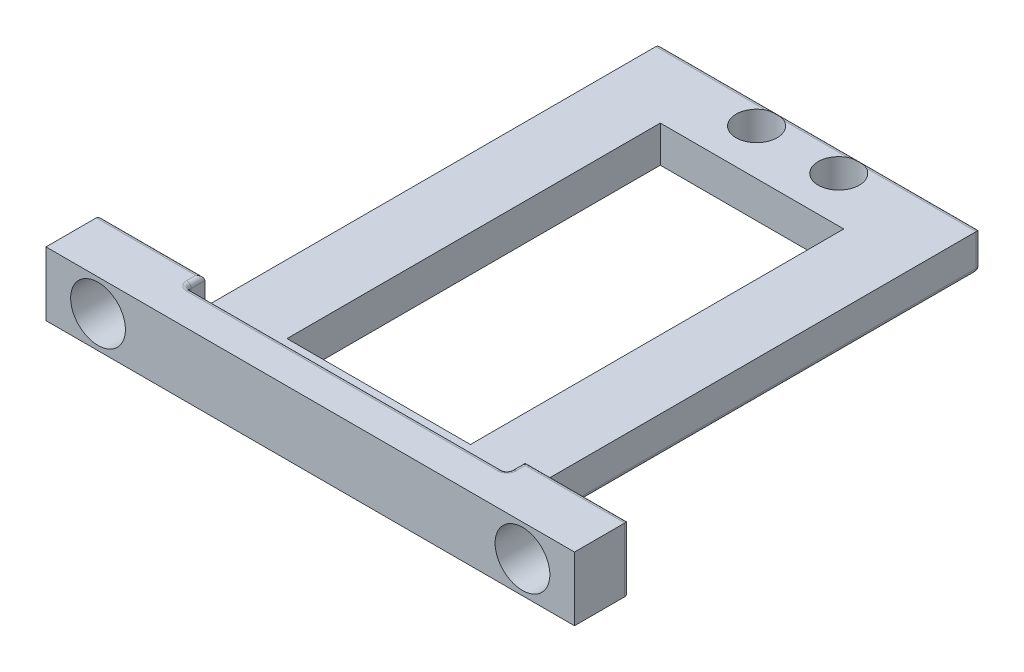
from build123d import *

# Parameters (mm, degrees)
ESQUISSE1_W             = 35.1
ESQUISSE1_H             = 55.9
ESQUISSE1_W_2           = 20.1
ESQUISSE1_H_2           = 40.9
BOSS_EXTRU_1_DEPTH      = 4
ESQUISSE5_W             = 17.55
ESQUISSE5_H             = 3
BOSS_EXTRU_2_DEPTH      = 4
ESQUISSE7_W             = 11.4
ESQUISSE7_H             = 7
BOSS_EXTRU_3_DEPTH      = 6
ESQUISSE8_R             = 3
ENL_V_MAT_EXTRU_1_DEPTH = 6
CONG_1_R                = 0.5
CONG_2_R                = 0.5
ENL_V_MAT_EXTRU_2_REACH = 47.983
ESQUISSE9_R             = 2.25


with BuildPart() as part:
    # Esquisse1 → Boss.-Extru.1 (new body)
    with BuildSketch(Plane(origin=(0, 0, 0), x_dir=(1, 0, 0), z_dir=(0, 1, 0))):
        with Locations((-6.45, -0.55)):
            Rectangle(ESQUISSE1_W, ESQUISSE1_H)
        with Locations((-6.45, -0.55)):
            Rectangle(ESQUISSE1_W_2, ESQUISSE1_H_2, mode=Mode.SUBTRACT)
    extrude(amount=BOSS_EXTRU_1_DEPTH)

    # Esquisse5 → Boss.-Extru.2 (add)
    with BuildSketch(Plane.XY.offset(28.5)):
        with Locations((2.325, 5.5)):
            Rectangle(ESQUISSE5_W, ESQUISSE5_H)
    boss_extru_2 = extrude(amount=-BOSS_EXTRU_2_DEPTH)

    # Symétrie1: Boss.-Extru.2 across plane
    add(boss_extru_2.mirror(Plane(origin=(-6.45, 0, 0), x_dir=(0, 0, 1), z_dir=(1, 0, 0))))

    # Esquisse7 → Boss.-Extru.3 (add)
    with BuildSketch(Plane.XY.offset(28.5)):
        with Locations((16.8, 3.5)):
            Rectangle(ESQUISSE7_W, ESQUISSE7_H)
    boss_extru_3 = extrude(amount=-BOSS_EXTRU_3_DEPTH)

    # Esquisse8 → Enlèv. mat.-Extru.1 (cut)
    with BuildSketch(Plane(origin=(0, 0, 22.5), x_dir=(-1, 0, 0), z_dir=(0, 0, -1))):
        with Locations((-16.8, 3.5)):
            Circle(ESQUISSE8_R)
    enl_v_mat_extru_1 = extrude(amount=-ENL_V_MAT_EXTRU_1_DEPTH, mode=Mode.SUBTRACT)

    # Symétrie2: Boss.-Extru.3 across plane
    add(boss_extru_3.mirror(Plane(origin=(-6.45, 0, 0), x_dir=(0, 0, 1), z_dir=(1, 0, 0))))

    # Symétrie3: Enlèv. mat.-Extru.1 across plane
    add(enl_v_mat_extru_1.mirror(Plane(origin=(-6.45, 0, 0), x_dir=(0, 0, 1), z_dir=(1, 0, 0))), mode=Mode.SUBTRACT)

    # Congé1
    cong_1_edges = [part.edges().sort_by_distance(p)[0] for p in [
        (11.1, 7, 23.5),
        (-24, 7, 23.5),
        (-24, 0, -2.45),
        (11.1, 0, -2.45),
        (11.1, 5.5, 24.5),
        (-6.45, 7, 24.5),
        (-24, 5.5, 24.5),
        (-6.45, 4, 24.5),
        (-29.7, 7, 22.5),
        (-35.4, 3.5, 22.5),
        (-29.7, 0, 22.5),
        (-24, 2, 22.5),
        (11.1, 2, 22.5),
        (16.8, 0, 22.5),
        (22.5, 3.5, 22.5),
        (16.8, 7, 22.5),
    ]]
    fillet(cong_1_edges, radius=CONG_1_R - 0.0001)  # a hair under: the kernel refuses the full size

    # Congé2
    cong_2_edges = [part.edges().sort_by_distance(p)[0] for p in [
        (-6.45, 0, -27.4),
        (10.95358268, 0.14641732, -27.4),
        (-23.85358268, 0.14641732, -27.4),
        (-6.45, 4, -27.4),
        (11.1, 2.24995, -27.4),
        (-24, 2.24995, -27.4),
    ]]
    fillet(cong_2_edges, radius=CONG_2_R - 0.0001)  # a hair under: the kernel refuses the full size

    # Esquisse9 → Enlèv. mat.-Extru.2 (cut, up to next)
    with BuildSketch(Plane.XZ, mode=Mode.PRIVATE) as enl_v_mat_extru_2_sk1:
        with Locations(Location((-1.95, -24.9, 0), (0, 0, 297.266044451))):
            Circle(ESQUISSE9_R)
    enl_v_mat_extru_2_tool1 = extrude(enl_v_mat_extru_2_sk1.sketch, amount=-ENL_V_MAT_EXTRU_2_REACH, mode=Mode.PRIVATE) & part.part
    # Esquisse9 → Enlèv. mat.-Extru.2 (cut, up to next)
    with BuildSketch(Plane.XZ, mode=Mode.PRIVATE) as enl_v_mat_extru_2_sk2:
        with Locations(Location((-10.95, -24.9, 0), (0, 0, 242.733955549))):
            Circle(ESQUISSE9_R)
    enl_v_mat_extru_2_tool2 = extrude(enl_v_mat_extru_2_sk2.sketch, amount=-ENL_V_MAT_EXTRU_2_REACH, mode=Mode.PRIVATE) & part.part
    add(enl_v_mat_extru_2_tool1.solids().sort_by_distance((-1.95, 0, -24.9))[0], mode=Mode.SUBTRACT)
    add(enl_v_mat_extru_2_tool2.solids().sort_by_distance((-10.95, 0, -24.9))[0], mode=Mode.SUBTRACT)


solid = part.part
